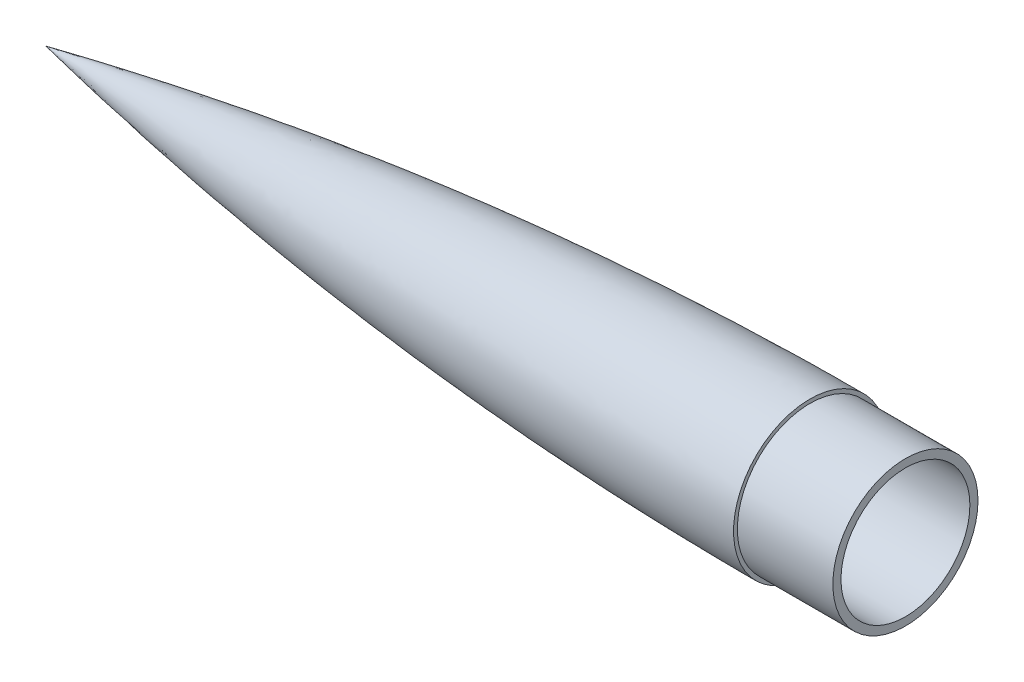
from build123d import *

# Parameters (mm, degrees)
SKETCH2_R           = 19.304
SKETCH2_R_2         = 17.145
BOSS_EXTRUDE1_DEPTH = 25.4


# Read off the part's stored shape, not the designer's step: Shell1
with BuildPart() as part:
    # Sketch1 → Revolve1 (revolve)
    with BuildSketch(Plane.XY):
        with BuildLine():
            Line((0, 1026.16), (0, 1005.84))
            Line((0, 1005.84), (-203.2, 1005.84))
            ThreePointArc((-203.2, 1005.84), (-102.106736311, 1021.067363106), (0, 1026.16))
        make_face()
    revolve(axis=Axis((0, 1005.84, 0), (-1, 0, 0)))

    # Shell1 outline → Shell1 (revolve, cut)
    with BuildSketch(Plane(origin=(0, 1005.84, 0), x_dir=(0, 1, 0), z_dir=(0, 0, -1))):
        with BuildLine():
            Line((0, 1e-07), (0, -186.505240208))
            add(Edge.make_bspline(
                [(0, -186.505240208), (17.145, -94.040670415), (17.145, 0)],
                knots=[6.099845176, 6.099845176, 6.099845176, 6.283185307, 6.283185307, 6.283185307], degree=2, weights=[1, 0.995801241, 1]))
            Line((17.145, 0), (0, 1e-07))
        make_face()
    revolve(axis=Axis((0, 1005.84, 0), (1, 0, 0)), mode=Mode.SUBTRACT)

    # Sketch2 → Boss-Extrude1 (add, symmetric)
    with BuildSketch(Plane(origin=(0, 0, 0), x_dir=(0, 0, -1), z_dir=(1, 0, 0))):
        with Locations((0, 1005.84)):
            Circle(SKETCH2_R)
        with Locations(Location((0, 1005.84, 0), (0, 0, 180))):
            Circle(SKETCH2_R_2, mode=Mode.SUBTRACT)
    extrude(amount=BOSS_EXTRUDE1_DEPTH, both=True)


solid = part.part
